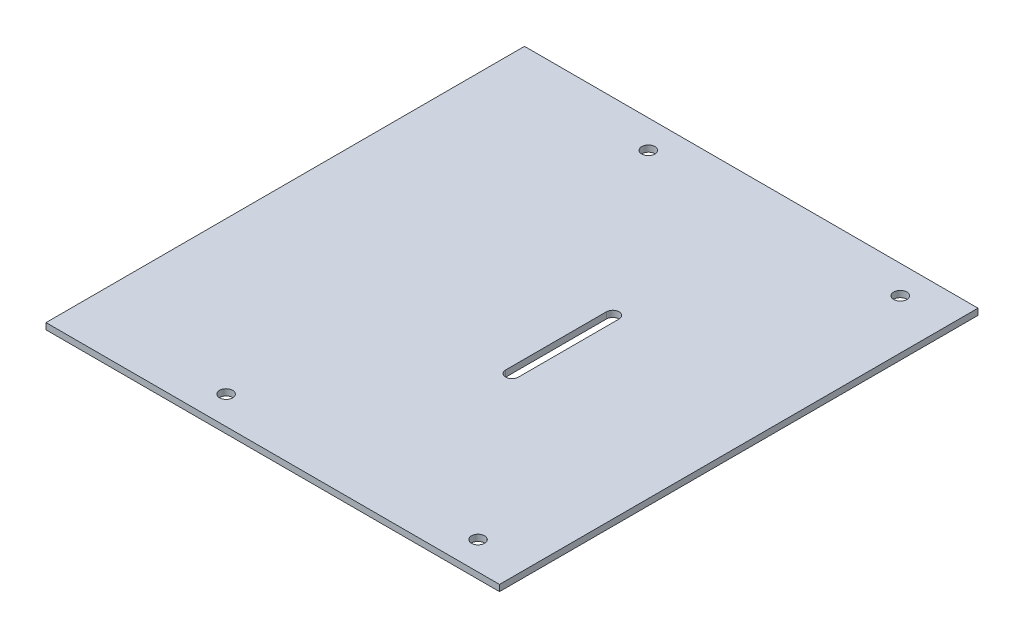
from build123d import *

# Parameters (mm, degrees)
SKETCH1_W               = 228.6
SKETCH1_H               = 241.2
BOSS_EXTRUDE1_DEPTH     = 1.5875
M6_CLEARANCE_HOLE1_D    = 6.6
CUT_EXTRUDE2_DEPTH      = 389.173341595
CUT_EXTRUDE2_DEPTH_BACK = 389.173341595


with BuildPart() as part:
    # Sketch1 → Boss-Extrude1 (new, symmetric)
    with BuildSketch(Plane(origin=(0, 0, 0), x_dir=(1, 0, 0), z_dir=(0, 1, 0))):
        with Locations((-254.65, 0)):
            Rectangle(SKETCH1_W, SKETCH1_H)
    extrude(amount=BOSS_EXTRUDE1_DEPTH, both=True)

    # M6 Clearance Hole1 (through all)
    with Locations(Plane(origin=(0, 1.5875, 0), x_dir=(1, 0, 0), z_dir=(0, 1, 0))):
        with Locations((-292.35, 106.425), (-165.35, 106.425), (-165.35, -106.425), (-292.35, -106.425)):
            Hole(M6_CLEARANCE_HOLE1_D / 2)

    # Sketch9 → Cut-Extrude2 (cut, two sides: drawn at the far end of the back side and taken through both)
    with BuildSketch(Plane(origin=(0, 1.5875, 0), x_dir=(1, 0, 0), z_dir=(0, 1, 0)).offset(-CUT_EXTRUDE2_DEPTH_BACK)):
        with BuildLine():
            Line((-226.075, -25.4), (-226.075, 25.4))
            ThreePointArc((-226.075, 25.4), (-229.25, 28.575), (-232.425, 25.4))
            Line((-232.425, 25.4), (-232.425, -25.4))
            ThreePointArc((-232.425, -25.4), (-229.25, -28.575), (-226.075, -25.4))
        make_face()
    extrude(amount=CUT_EXTRUDE2_DEPTH + CUT_EXTRUDE2_DEPTH_BACK, mode=Mode.SUBTRACT)


solid = part.part
